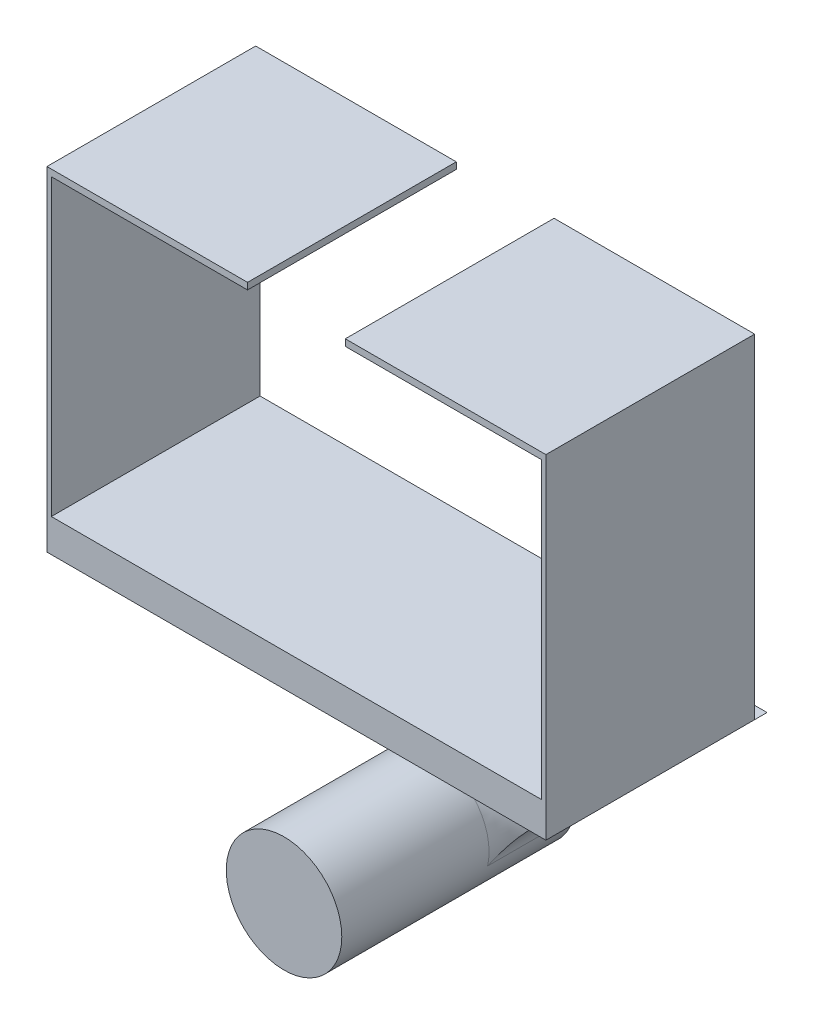
from build123d import *

# Parameters (mm, degrees)
SKETCH1_R           = 7.472749452
BOSS_EXTRUDE1_DEPTH = 25.4
SKETCH2_W           = 14.945498904
SKETCH2_H           = 22.418248356
BOSS_EXTRUDE2_DEPTH = 3.20842108
SKETCH4_W           = 63.40856
SKETCH4_H           = 4.26981756
BOSS_EXTRUDE3_DEPTH = 27.00421054
SKETCH6_W           = 27.00421054
SKETCH6_H           = 4.26981756
BOSS_EXTRUDE4_DEPTH = 0.56888896
SKETCH7_W           = 0.56888896
SKETCH7_H           = 27.00421054
BOSS_EXTRUDE5_DEPTH = 38.0746
SKETCH8_W           = 0.56888896
SKETCH8_H           = 27.00421054
BOSS_EXTRUDE6_DEPTH = 0.853447309
SKETCH9_W           = 27.00421054
SKETCH9_H           = 0.853447309
BOSS_EXTRUDE7_DEPTH = 25.37968
BOSS_EXTRUDE8_DEPTH = 3.20842108
FILLET4_R           = 6.35
FILLET5_R           = 6.35
BOSS_EXTRUDE9_DEPTH = 1.60421054


with BuildPart() as part:
    # Sketch1 → Boss-Extrude1 (new body)
    with BuildSketch(Plane.XY):
        Circle(SKETCH1_R)
    extrude(amount=-BOSS_EXTRUDE1_DEPTH)

    # Sketch2 → Boss-Extrude2 (add)
    with BuildSketch(Plane(origin=(0, 0, -25.4), x_dir=(-1, 0, 0), z_dir=(0, 0, -1))):
        with BuildLine():
            ThreePointArc((7.472749452, 0), (0, 7.472749452), (-7.472749452, 0))
            Line((-7.472749452, 0), (7.472749452, 0))
        make_face()
        with BuildLine():
            Line((7.472749452, 0), (-7.472749452, 0))
            ThreePointArc((-7.472749452, 0), (0, -7.472749452), (7.472749452, 0))
        make_face()
        with BuildLine():
            ThreePointArc((7.472749452, 0), (0, 7.472749452), (-7.472749452, 0))
            Line((-7.472749452, 0), (7.472749452, 0))
        make_face()
        with BuildLine():
            Line((7.472749452, 0), (-7.472749452, 0))
            ThreePointArc((-7.472749452, 0), (0, -7.472749452), (7.472749452, 0))
        make_face()
        with Locations((0, 11.209124178)):
            Rectangle(SKETCH2_W, SKETCH2_H)
    extrude(amount=BOSS_EXTRUDE2_DEPTH)

    # Sketch4 → Boss-Extrude3 (add)
    with BuildSketch(Plane(origin=(0, 0, -28.60842108), x_dir=(-1, 0, 0), z_dir=(0, 0, -1))):
        with Locations((0, 24.553157136)):
            Rectangle(SKETCH4_W, SKETCH4_H)
    extrude(amount=-BOSS_EXTRUDE3_DEPTH)

    # Sketch6 → Boss-Extrude4 (add)
    with BuildSketch(Plane(origin=(31.70428, 0, 0), x_dir=(0, 0, -1), z_dir=(1, 0, 0))):
        with Locations((15.10631581, 24.553157136)):
            Rectangle(SKETCH6_W, SKETCH6_H)
    boss_extrude4 = extrude(amount=BOSS_EXTRUDE4_DEPTH)

    # Sketch7 → Boss-Extrude5 (add)
    with BuildSketch(Plane(origin=(0, 26.688065916, 0), x_dir=(1, 0, 0), z_dir=(0, 1, 0))):
        with Locations((31.98872448, 15.10631581)):
            Rectangle(SKETCH7_W, SKETCH7_H)
    boss_extrude5 = extrude(amount=BOSS_EXTRUDE5_DEPTH)

    # Sketch8 → Boss-Extrude6 (add)
    with BuildSketch(Plane(origin=(0, 64.762665916, 0), x_dir=(1, 0, 0), z_dir=(0, 1, 0))):
        with Locations((31.98872448, 15.10631581)):
            Rectangle(SKETCH8_W, SKETCH8_H)
    boss_extrude6 = extrude(amount=BOSS_EXTRUDE6_DEPTH)

    # Sketch9 → Boss-Extrude7 (add)
    with BuildSketch(Plane.ZY.offset(-31.70428)):
        with Locations((-15.10631581, 65.18938957)):
            Rectangle(SKETCH9_W, SKETCH9_H)
    boss_extrude7 = extrude(amount=BOSS_EXTRUDE7_DEPTH)

    # Mirror1: Boss-Extrude4, Boss-Extrude5, Boss-Extrude6, Boss-Extrude7 across plane
    add(boss_extrude4.mirror(Plane(origin=(0, 0, 0), x_dir=(0, 0, 1), z_dir=(1, 0, 0))))
    add(boss_extrude5.mirror(Plane(origin=(0, 0, 0), x_dir=(0, 0, 1), z_dir=(1, 0, 0))))
    add(boss_extrude6.mirror(Plane(origin=(0, 0, 0), x_dir=(0, 0, 1), z_dir=(1, 0, 0))))
    add(boss_extrude7.mirror(Plane(origin=(0, 0, 0), x_dir=(0, 0, 1), z_dir=(1, 0, 0))))

    # Sketch13 → Boss-Extrude8 (add)
    with BuildSketch(Plane(origin=(0, 0, -28.60842108), x_dir=(-1, 0, 0), z_dir=(0, 0, -1))):
        Polygon((-7.472749452, 0), (-32.27316896, 22.418248356), (-7.472749452, 22.418248356), align=None)
        Polygon((7.472749452, 0), (32.27316896, 22.418248356), (7.472749452, 22.418248356), align=None)
    extrude(amount=-BOSS_EXTRUDE8_DEPTH)

    # Fillet4
    fillet4_edges = [part.edges().sort_by_distance(p)[0] for p in [
        (0, 22.418248356, -25.4),
    ]]
    fillet(fillet4_edges, radius=FILLET4_R)

    # Fillet5
    # the kernel refuses this fillet: 6.35 mm, written as the material it adds along each edge
    with BuildSketch(Plane(origin=(0, 0, -25.4), x_dir=(0.003141587485879873, -0.9999950652018582, 0), z_dir=(-0.9999950652018582, -0.003141587485879873, 0))) as fillet5_piece_1_section:
        with BuildLine():
            CenterArc((7.472749452 + FILLET5_R, FILLET5_R), FILLET5_R, 180, 90)
            Line((7.472749452 + FILLET5_R, 0), (7.472749452 + FILLET5_R, -FILLET5_R * 0.02))
            Line((7.472749452 + FILLET5_R, -FILLET5_R * 0.02), (7.472749452 - FILLET5_R * 0.02, -FILLET5_R * 0.02))
            Line((7.472749452 - FILLET5_R * 0.02, -FILLET5_R * 0.02), (7.472749452 - FILLET5_R * 0.02, FILLET5_R))
            Line((7.472749452 - FILLET5_R * 0.02, FILLET5_R), (7.472749452, FILLET5_R))
        make_face()
    fillet5_piece_1 = revolve(axis=Axis((0, 0, -25.4), (0, 0, 1)), revolution_arc=359.64, mode=Mode.PRIVATE)
    fillet5_piece_1 = split(fillet5_piece_1, bisect_by=Plane(origin=(-7.980408712, 0.458896729, -23.585442905), z_dir=(0.6705805717075095, 0.7418367049751783, 0)), keep=Keep.TOP, mode=Mode.PRIVATE)
    fillet5_piece_1 = split(fillet5_piece_1, bisect_by=Plane(origin=(7.980408712, 0.458896729, -23.585442905), z_dir=(-0.6705805717075095, 0.7418367049751783, 0)), keep=Keep.TOP, mode=Mode.PRIVATE)
    add(fillet5_piece_1)
    with BuildSketch(Plane(origin=(7.472749452, 0, -25.4), x_dir=(-0.11463149337271429, -0.9934080836832069, 0), z_dir=(0, 0, -1))) as fillet5_piece_2:
        with BuildLine():
            CenterArc((2.441134842, -6.308141331), FILLET5_R, 96.582370614, 34.723369341)
            Line((-1.750353646, -1.538033968), (-1.834183416, -1.44263182))
            Line((-1.834183416, -1.44263182), (-0.08382977, 0.095402147))
            Line((-0.08382977, 0.095402147), (0.0145582, 0.126162827))
            ThreePointArc((0.0145582, 0.126162827), (0.856612429, 0.077740261), (1.698666659, 0.126162827))
            Line((1.698666659, 0.126162827), (1.713224859, 0))
        make_face()
    extrude(amount=3.20842108)
    with BuildSketch(Plane(origin=(-7.472749452, 0, -25.4), x_dir=(-0.7418367049751787, 0.6705805717075091, 0), z_dir=(0, 0, -1))) as fillet5_piece_3:
        with BuildLine():
            CenterArc((2.330082911, -6.35), FILLET5_R, 90, 34.723369341)
            Line((-1.286971105, -1.1308602), (-1.359312185, -1.026477404))
            ThreePointArc((-1.359312185, -1.026477404), (-0.694800105, -0.507031771), (-0.094213262, 0.085163733))
            Line((-0.094213262, 0.085163733), (0, 0.127))
            Line((0, 0.127), (2.330082911, 0.127))
            Line((2.330082911, 0.127), (2.330082911, 0))
        make_face()
    extrude(amount=3.20842108)
    with BuildSketch(Plane(origin=(7.472749452, 0, -11.419502535), x_dir=(-0.11463149337271447, -0.9934080836832069, 0), z_dir=(0, 0, -1))) as fillet5_piece_4a_section:
        with BuildLine():
            CenterArc((2.441134842, -6.308141331), FILLET5_R, 96.582370614, 34.723369341)
            Line((-1.750353646, -1.538033968), (-1.834183416, -1.44263182))
            Line((-1.834183416, -1.44263182), (-0.08382977, 0.095402147))
            Line((-0.08382977, 0.095402147), (0.0145582, 0.126162827))
            ThreePointArc((0.0145582, 0.126162827), (0.856612429, 0.077740261), (1.698666659, 0.126162827))
            Line((1.698666659, 0.126162827), (1.713224859, 0))
        make_face()
    fillet5_piece_4a = extrude(amount=17.188918545, mode=Mode.PRIVATE)
    fillet5_piece_4a = split(fillet5_piece_4a, bisect_by=Plane(origin=(7.858473842, 0.054386522, -25.4), z_dir=(0, 0, 1)), keep=Keep.TOP, mode=Mode.PRIVATE)
    with BuildSketch(Plane(origin=(0, 0, -25.4), x_dir=(0.003141587485879873, -0.9999950652018582, 0), z_dir=(-0.9999950652018582, -0.003141587485879873, 0))) as fillet5_piece_4b_section:
        with BuildLine():
            CenterArc((7.472749452 + FILLET5_R, FILLET5_R), FILLET5_R, 180, 90)
            Line((7.472749452 + FILLET5_R, 0), (7.472749452 + FILLET5_R, -FILLET5_R * 0.02))
            Line((7.472749452 + FILLET5_R, -FILLET5_R * 0.02), (7.472749452 - FILLET5_R * 0.02, -FILLET5_R * 0.02))
            Line((7.472749452 - FILLET5_R * 0.02, -FILLET5_R * 0.02), (7.472749452 - FILLET5_R * 0.02, FILLET5_R))
            Line((7.472749452 - FILLET5_R * 0.02, FILLET5_R), (7.472749452, FILLET5_R))
        make_face()
    fillet5_piece_4b = revolve(axis=Axis((0, 0, -25.4), (0, 0, 1)), revolution_arc=359.64, mode=Mode.PRIVATE)
    fillet5_piece_4b = split(fillet5_piece_4b, bisect_by=Plane(origin=(2.712448107, -9.20687202, -24.086642783), z_dir=(0.6705805717075095, 0.7418367049751783, 0)), keep=Keep.TOP, mode=Mode.PRIVATE)
    fillet5_piece_4b = split(fillet5_piece_4b, bisect_by=Plane(origin=(4.884392341, -2.339735928, -24.086642783), z_dir=(0.6705805717075095, -0.7418367049751783, 0)), keep=Keep.TOP, mode=Mode.PRIVATE)
    fillet5_piece_4 = fillet5_piece_4a & fillet5_piece_4b
    add(fillet5_piece_4)
    with BuildSketch(Plane(origin=(-7.472749452, 0, -11.419502535), x_dir=(-0.7418367049751784, 0.6705805717075094, 0), z_dir=(0, 0, -1))) as fillet5_piece_5a_section:
        with BuildLine():
            CenterArc((2.330082911, -6.35), FILLET5_R, 90, 34.723369341)
            Line((-1.286971105, -1.1308602), (-1.359312185, -1.026477404))
            ThreePointArc((-1.359312185, -1.026477404), (-0.694800105, -0.507031771), (-0.094213262, 0.085163733))
            Line((-0.094213262, 0.085163733), (0, 0.127))
            Line((0, 0.127), (2.330082911, 0.127))
            Line((2.330082911, 0.127), (2.330082911, 0))
        make_face()
    fillet5_piece_5a = extrude(amount=17.188918545, mode=Mode.PRIVATE)
    fillet5_piece_5a = split(fillet5_piece_5a, bisect_by=Plane(origin=(-7.858473842, 0.054386522, -25.4), z_dir=(0, 0, 1)), keep=Keep.TOP, mode=Mode.PRIVATE)
    with BuildSketch(Plane(origin=(0, 0, -25.4), x_dir=(0.003141587485879873, -0.9999950652018582, 0), z_dir=(-0.9999950652018582, -0.003141587485879873, 0))) as fillet5_piece_5b_section:
        with BuildLine():
            CenterArc((7.472749452 + FILLET5_R, FILLET5_R), FILLET5_R, 180, 90)
            Line((7.472749452 + FILLET5_R, 0), (7.472749452 + FILLET5_R, -FILLET5_R * 0.02))
            Line((7.472749452 + FILLET5_R, -FILLET5_R * 0.02), (7.472749452 - FILLET5_R * 0.02, -FILLET5_R * 0.02))
            Line((7.472749452 - FILLET5_R * 0.02, -FILLET5_R * 0.02), (7.472749452 - FILLET5_R * 0.02, FILLET5_R))
            Line((7.472749452 - FILLET5_R * 0.02, FILLET5_R), (7.472749452, FILLET5_R))
        make_face()
    fillet5_piece_5b = revolve(axis=Axis((0, 0, -25.4), (0, 0, 1)), revolution_arc=359.64, mode=Mode.PRIVATE)
    fillet5_piece_5b = split(fillet5_piece_5b, bisect_by=Plane(origin=(-4.884392341, -2.339735928, -24.086642783), z_dir=(-0.6705805717075095, -0.7418367049751783, 0)), keep=Keep.TOP, mode=Mode.PRIVATE)
    fillet5_piece_5b = split(fillet5_piece_5b, bisect_by=Plane(origin=(-2.712448107, -9.20687202, -24.086642783), z_dir=(-0.6705805717075095, 0.7418367049751783, 0)), keep=Keep.TOP, mode=Mode.PRIVATE)
    fillet5_piece_5 = fillet5_piece_5a & fillet5_piece_5b
    add(fillet5_piece_5)

    # Sketch14 → Boss-Extrude9 (add)
    with BuildSketch(Plane(origin=(0, 0, -28.60842108), x_dir=(-1, 0, 0), z_dir=(0, 0, -1))):
        with BuildLine():
            Line((-32.27316896, 22.418248356), (-25.92316896, 22.418248356))
            Line((-25.92316896, 22.418248356), (0, 0))
            Line((0, 0), (25.92316896, 22.418248356))
            Line((25.92316896, 22.418248356), (32.27316896, 22.418248356))
            Line((32.27316896, 22.418248356), (9.201290481, 1.56250833))
            ThreePointArc((9.201290481, 1.56250833), (7.989618973, 0.077237004), (7.276359928, -1.701931424))
            ThreePointArc((7.276359928, -1.701931424), (0, -7.472749452), (-7.276359928, -1.701931424))
            ThreePointArc((-7.276359928, -1.701931424), (-7.989618973, 0.077237004), (-9.201290481, 1.56250833))
            Line((-9.201290481, 1.56250833), (-32.27316896, 22.418248356))
        make_face()
    extrude(amount=BOSS_EXTRUDE9_DEPTH)


solid = part.part
